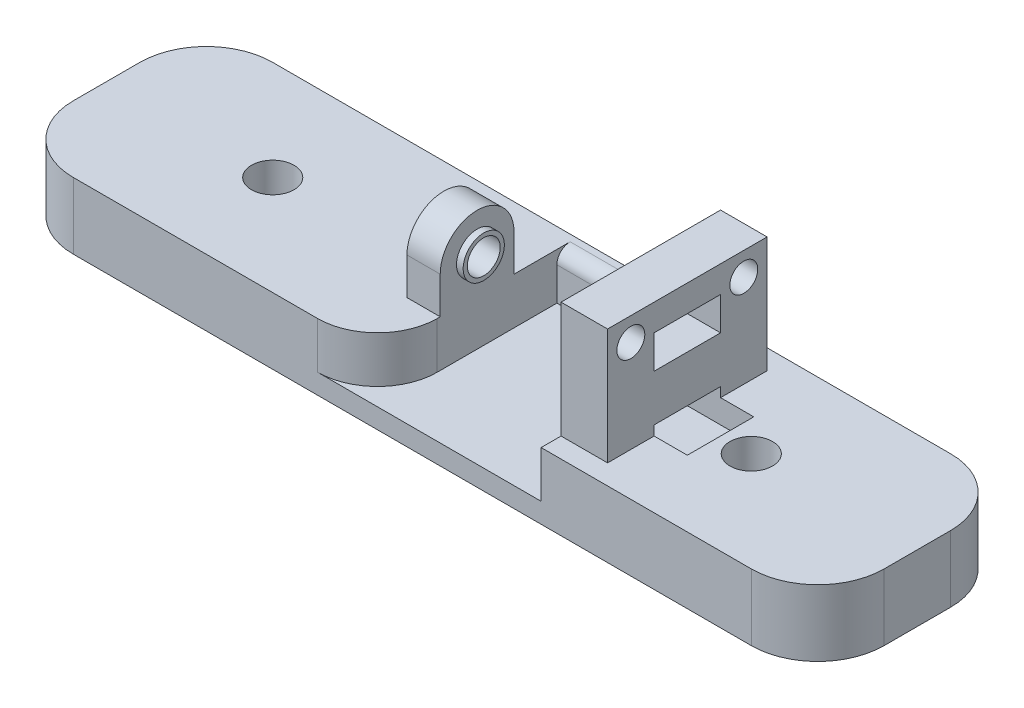
from build123d import *

# Parameters (mm, degrees)
SKETCH1_W           = 122
SKETCH1_H           = 30
BOSS_EXTRUDE1_DEPTH = 10
SKETCH2_W           = 24
SKETCH2_H           = 17.447802
BOSS_EXTRUDE2_DEPTH = 7
SKETCH3_R           = 2.475
BOSS_EXTRUDE3_DEPTH = 5
SKETCH4_W           = 24.63
SKETCH4_H           = 27
CUT_EXTRUDE1_DEPTH  = 7
FILLET1_R           = 10
SKETCH7_R           = 3.2
CUT_EXTRUDE2_DEPTH  = 66.195289666
BOSS_EXTRUDE5_START = 1
SKETCH8_R           = 3.1
SKETCH8_R_2         = 2.475
BOSS_EXTRUDE5_DEPTH = 1
FILLET2_R           = 9
FILLET3_R           = 2
SKETCH9_R           = 2.1
CUT_EXTRUDE3_DEPTH  = 8
SKETCH10_W          = 10
SKETCH10_H          = 5
CUT_EXTRUDE4_DEPTH  = 12


with BuildPart() as part:
    # Sketch1 → Boss-Extrude1 (new body)
    with BuildSketch(Plane(origin=(0, 0, 0), x_dir=(1, 0, 0), z_dir=(0, 1, 0))):
        Rectangle(SKETCH1_W, SKETCH1_H)
    extrude(amount=BOSS_EXTRUDE1_DEPTH)

    # Sketch2 → Boss-Extrude2 (add)
    with BuildSketch(Plane(origin=(19.38, 0, 0), x_dir=(0, 0, -1), z_dir=(1, 0, 0))):
        with Locations((0, 18.723901)):
            Rectangle(SKETCH2_W, SKETCH2_H)
    extrude(amount=BOSS_EXTRUDE2_DEPTH)

    # Sketch3 → Boss-Extrude3 (add)
    with BuildSketch(Plane(origin=(-5.25, 0, 0), x_dir=(0, 0, -1), z_dir=(1, 0, 0))):
        with BuildLine():
            Line((-5.552198, 15.552198), (-5.552198, 10))
            Line((-5.552198, 10), (5.552198, 10))
            Line((5.552198, 10), (5.552198, 15.552198))
            ThreePointArc((5.552198, 15.552198), (0, 21.104396), (-5.552198, 15.552198))
        make_face()
        with Locations((0, 15.552198)):
            Circle(SKETCH3_R, mode=Mode.SUBTRACT)
    extrude(amount=-BOSS_EXTRUDE3_DEPTH)

    # Sketch4 → Cut-Extrude1 (cut)
    with BuildSketch(Plane(origin=(0, 10, 0), x_dir=(1, 0, 0), z_dir=(0, 1, 0))):
        with Locations((7.065, -1.5)):
            Rectangle(SKETCH4_W, SKETCH4_H)
    extrude(amount=-CUT_EXTRUDE1_DEPTH, mode=Mode.SUBTRACT)

    # Fillet1
    fillet1_edges = [part.edges().sort_by_distance(p)[0] for p in [
        (-61, 5, -15),
        (-61, 5, 15),
        (61, 5, -15),
        (61, 5, 15),
    ]]
    fillet(fillet1_edges, radius=FILLET1_R)

    # Sketch7 → Cut-Extrude2 (cut, through all)
    with BuildSketch(Plane(origin=(0, 10, 0), x_dir=(1, 0, 0), z_dir=(0, 1, 0))):
        with Locations((-36, 0)):
            Circle(SKETCH7_R)
        with Locations((36, 0)):
            Circle(SKETCH7_R)
    extrude(amount=-CUT_EXTRUDE2_DEPTH, mode=Mode.SUBTRACT)

    # Sketch8 → Boss-Extrude5 (add)
    with BuildSketch(Plane(origin=(-5.25, 0, 0), x_dir=(0, 0, -1), z_dir=(1, 0, 0)).offset(BOSS_EXTRUDE5_START)):
        with Locations((0, 15.552198)):
            Circle(SKETCH8_R)
        with Locations((0, 15.552198)):
            Circle(SKETCH8_R_2, mode=Mode.SUBTRACT)
    extrude(amount=-BOSS_EXTRUDE5_DEPTH)

    # Fillet2
    fillet2_edges = [part.edges().sort_by_distance(p)[0] for p in [
        (-5.25, 6.5, 15),
    ]]
    fillet(fillet2_edges, radius=FILLET2_R)

    # Fillet3
    fillet3_edges = [part.edges().sort_by_distance(p)[0] for p in [
        (7.065, 10, -12),
    ]]
    fillet(fillet3_edges, radius=FILLET3_R)

    # Sketch9 → Cut-Extrude3 (cut)
    with BuildSketch(Plane.ZY.offset(-19.38)):
        with Locations((8.5, 23.947802)):
            Circle(SKETCH9_R)
        with Locations((8.5, 6.947802)):
            Circle(SKETCH9_R)
        with Locations((-8.5, 6.947802)):
            Circle(SKETCH9_R)
        with Locations((-8.5, 23.947802)):
            Circle(SKETCH9_R)
    extrude(amount=-CUT_EXTRUDE3_DEPTH, mode=Mode.SUBTRACT)

    # Sketch10 → Cut-Extrude4 (cut)
    with BuildSketch(Plane.ZY.offset(-19.38)):
        with Locations((0, 20.947802)):
            Rectangle(SKETCH10_W, SKETCH10_H)
        with Locations((0, 8.947802)):
            Rectangle(SKETCH10_W, SKETCH10_H)
    extrude(amount=-CUT_EXTRUDE4_DEPTH, mode=Mode.SUBTRACT)


solid = part.part
